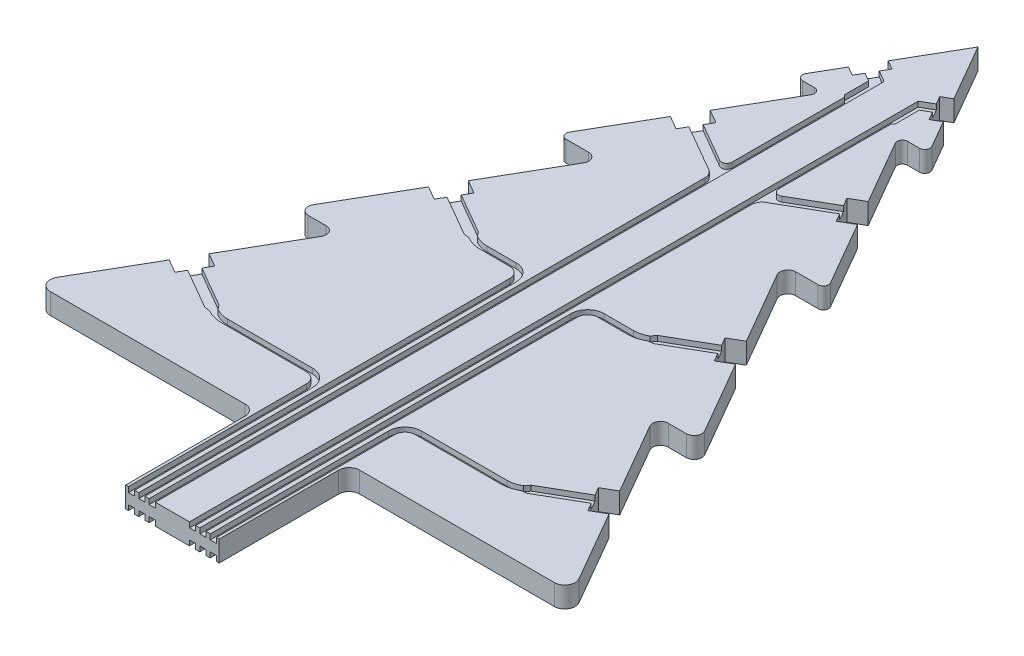
from build123d import *

# Parameters (mm, degrees)
ESBO_O1_W                       = 18
ESBO_O1_H                       = 25
RVORE_DEPTH                     = 4
FILETE2_R                       = 1
FILETE3_R                       = 1
FILETE4_R                       = 1
FILETE5_R                       = 1
FILETE6_R                       = 1
FILETE7_R                       = 1
FILETE8_R                       = 1.5
FILETE9_R                       = 1.5
FILETE10_R                      = 1.5
FILETE11_R                      = 1.5
FILETE12_R                      = 2
FILETE13_R                      = 2
FILETE14_R                      = 2
FILETE15_R                      = 2
FILETE16_R                      = 1.5
FILETE17_R                      = 1.5
CORTES_DO_LED_DEPTH             = 10
V_OS_DEPTH                      = 1
FILETE18_R                      = 2
FILETE19_R                      = 1
CHANFRO7_SIZE                   = 0.5
CORTE_EXTRUS_O1_START           = -1
CORTE_EXTRUS_O1_DEPTH           = 1
FILETE20_R                      = 1.5
FILETE21_R                      = 1.5
CHANFRO8_SIZE                   = 0.5
ESPELHAR_START                  = 3
ESPELHAR_V_OS_DA_FRENTE_DEPTH   = 1
ESPELHAR_V_OS_DA_TRASEIRA_DEPTH = 1


# Read off the part's stored shape, not the designer's step: Espelhar Vãos da Frente, Espelhar Vãos da Traseira
with BuildPart() as part:
    # Esboço1 → rvore (new body)
    with BuildSketch(Plane(origin=(0, 0, 0), x_dir=(1, 0, 0), z_dir=(0, 1, 0))):
        with Locations((0, -127.5)):
            Rectangle(ESBO_O1_W, ESBO_O1_H)
        Polygon((-51.961524227, -115), (-9, -115), (9, -115), (51.961524227, -115), (30.310889132, -77.5), (-30.310889132, -77.5), align=None)
        Polygon((-8.660254038, -40), (-30.310889132, -77.5), (30.310889132, -77.5), (8.660254038, -40), align=None)
        Polygon((-17.320508076, -40), (-8.660254038, -40), (0, -25), (8.660254038, -40), (17.320508076, -40), (0, -10), align=None)
        Polygon((8.660254038, -40), (30.310889132, -77.5), (38.97114317, -77.5), (17.320508076, -40), align=None)
        Polygon((0, -25), (-8.660254038, -40), (8.660254038, -40), align=None)
        Polygon((-38.97114317, -77.5), (-30.310889132, -77.5), (-8.660254038, -40), (-17.320508076, -40), align=None)
        Polygon((-25.980762114, -40), (-17.320508076, -40), (0, -10), (17.320508076, -40), (25.980762114, -40), (7.216878365, -7.5), (-7.216878365, -7.5), align=None)
        Polygon((0, 5), (-7.216878365, -7.5), (7.216878365, -7.5), align=None)
        Polygon((-12.990381057, -7.5), (-7.216878365, -7.5), (0, 5), (7.216878365, -7.5), (12.990381057, -7.5), (0, 15), align=None)
    extrude(amount=RVORE_DEPTH)

    # Filete2
    filete2_edges = [part.edges().sort_by_distance(p)[0] for p in [
        (12.990381057, 2, 7.5),
    ]]
    fillet(filete2_edges, radius=FILETE2_R)

    # Filete3
    filete3_edges = [part.edges().sort_by_distance(p)[0] for p in [
        (-12.990381057, 2, 7.5),
    ]]
    fillet(filete3_edges, radius=FILETE3_R)

    # Filete4
    filete4_edges = [part.edges().sort_by_distance(p)[0] for p in [
        (-7.216878365, 2, 7.5),
    ]]
    fillet(filete4_edges, radius=FILETE4_R)

    # Filete5
    filete5_edges = [part.edges().sort_by_distance(p)[0] for p in [
        (7.216878365, 2, 7.5),
    ]]
    fillet(filete5_edges, radius=FILETE5_R)

    # Filete6
    filete6_edges = [part.edges().sort_by_distance(p)[0] for p in [
        (25.980762114, 2, 40),
    ]]
    fillet(filete6_edges, radius=FILETE6_R)

    # Filete7
    filete7_edges = [part.edges().sort_by_distance(p)[0] for p in [
        (-25.980762114, 2, 40),
    ]]
    fillet(filete7_edges, radius=FILETE7_R)

    # Filete8
    filete8_edges = [part.edges().sort_by_distance(p)[0] for p in [
        (17.320508076, 2, 40),
    ]]
    fillet(filete8_edges, radius=FILETE8_R)

    # Filete9
    filete9_edges = [part.edges().sort_by_distance(p)[0] for p in [
        (-17.320508076, 2, 40),
    ]]
    fillet(filete9_edges, radius=FILETE9_R)

    # Filete10
    filete10_edges = [part.edges().sort_by_distance(p)[0] for p in [
        (38.97114317, 2, 77.5),
    ]]
    fillet(filete10_edges, radius=FILETE10_R)

    # Filete11
    filete11_edges = [part.edges().sort_by_distance(p)[0] for p in [
        (-38.97114317, 2, 77.5),
    ]]
    fillet(filete11_edges, radius=FILETE11_R)

    # Filete12
    filete12_edges = [part.edges().sort_by_distance(p)[0] for p in [
        (51.961524227, 2, 115),
    ]]
    fillet(filete12_edges, radius=FILETE12_R)

    # Filete13
    filete13_edges = [part.edges().sort_by_distance(p)[0] for p in [
        (-51.961524227, 2, 115),
    ]]
    fillet(filete13_edges, radius=FILETE13_R)

    # Filete14
    filete14_edges = [part.edges().sort_by_distance(p)[0] for p in [
        (9, 2, 115),
    ]]
    fillet(filete14_edges, radius=FILETE14_R)

    # Filete15
    filete15_edges = [part.edges().sort_by_distance(p)[0] for p in [
        (-9, 2, 115),
    ]]
    fillet(filete15_edges, radius=FILETE15_R)

    # Filete16
    filete16_edges = [part.edges().sort_by_distance(p)[0] for p in [
        (30.310889132, 2, 77.5),
    ]]
    fillet(filete16_edges, radius=FILETE16_R)

    # Filete17
    filete17_edges = [part.edges().sort_by_distance(p)[0] for p in [
        (-30.310889132, 2, 77.5),
    ]]
    fillet(filete17_edges, radius=FILETE17_R)

    # Esboço5 → Cortes do Led (cut)
    with BuildSketch(Plane(origin=(0, 4, 0), x_dir=(1, 0, 0), z_dir=(0, 1, 0))):
        Polygon((42.319473419, -98.299478112), (39.519473419, -93.449735851), (36.921397208, -94.949735851), (39.721397208, -99.799478112), align=None)
        Polygon((29.544605065, -61.172757061), (26.744605065, -56.3230148), (24.146528853, -57.8230148), (26.946528853, -62.672757061), align=None)
        Polygon((17.99973671, -26.176458504), (15.19973671, -21.326716243), (12.601660498, -22.826716243), (15.401660498, -27.676458504), align=None)
        Polygon((9.124355653, -0.803847577), (6.324355653, 4.045894684), (4.592304845, 3.045894684), (7.392304845, -1.803847577), align=None)
        Polygon((-9.124355653, -0.803847577), (-6.324355653, 4.045894684), (-4.592304845, 3.045894684), (-7.392304845, -1.803847577), align=None)
        Polygon((-17.99973671, -26.176458504), (-15.19973671, -21.326716243), (-12.601660498, -22.826716243), (-15.401660498, -27.676458504), align=None)
        Polygon((-29.544605065, -61.172757061), (-26.744605065, -56.3230148), (-24.146528853, -57.8230148), (-26.946528853, -62.672757061), align=None)
        Polygon((-42.319473419, -98.299478112), (-39.519473419, -93.449735851), (-36.921397208, -94.949735851), (-39.721397208, -99.799478112), align=None)
    extrude(amount=-CORTES_DO_LED_DEPTH, mode=Mode.SUBTRACT)

    # Esboço6 → Vãos (cut)
    with BuildSketch(Plane(origin=(0, 4, 0), x_dir=(1, 0, 0), z_dir=(0, 1, 0))):
        Polygon((3.275, -140), (4.475, -140), (4.475, -31.906507915), (14.501660498, -26.117612777), (13.501660498, -24.38556197), (4.475, -29.597106838), (4.475, -5.716873023), (4.875, -5.716873023), (4.875, -1.178753238), (6.492304845, -0.24500185), (5.492304845, 1.487048957), (3.275, 0.206887408), align=None)
        with BuildLine():
            Line((5.275, -68.59814367), (5.275, -140))
            Line((5.275, -140), (6.475, -140))
            Line((6.475, -140), (6.475, -68.59814367))
            ThreePointArc((6.475, -68.59814367), (7.060786438, -67.183930107), (8.475, -66.59814367))
            Line((8.475, -66.59814367), (14.086274815, -66.59814367))
            ThreePointArc((14.086274815, -66.59814367), (15.690952895, -66.386883793), (17.186274815, -65.767501173))
            Line((17.186274815, -65.767501173), (18.252300219, -65.613911335))
            Line((18.252300219, -65.613911335), (26.046528853, -61.113911335))
            Line((26.046528853, -61.113911335), (25.046528853, -59.381860527))
            Line((25.046528853, -59.381860527), (17.252300219, -63.881860527))
            Line((17.252300219, -63.881860527), (16.586274815, -64.728270689))
            ThreePointArc((16.586274815, -64.728270689), (15.380370041, -65.227772801), (14.086274815, -65.39814367))
            Line((14.086274815, -65.39814367), (8.475, -65.39814367))
            ThreePointArc((8.475, -65.39814367), (6.2122583, -66.33540197), (5.275, -68.59814367))
        make_face()
        with BuildLine():
            Line((7.275, -105.724864812), (7.275, -140))
            Line((7.275, -140), (8.475000015, -140))
            Line((8.475000015, -140), (8.475000015, -105.724864812))
            ThreePointArc((8.475000015, -105.724864812), (9.060786384, -104.310651231), (10.47499994, -103.724864804))
            Line((10.47499994, -103.724864804), (26.861143115, -103.724864804))
            ThreePointArc((26.861143115, -103.724864804), (28.465821237, -103.513604922), (29.96114317, -102.894222224))
            Line((29.96114317, -102.894222224), (31.027168574, -102.740632385))
            Line((31.027168574, -102.740632385), (38.821397208, -98.240632385))
            Line((38.821397208, -98.240632385), (37.821397208, -96.508581578))
            Line((37.821397208, -96.508581578), (30.027168574, -101.008581578))
            Line((30.027168574, -101.008581578), (29.36114317, -101.854991739))
            ThreePointArc((29.36114317, -101.854991739), (28.155238386, -102.354493946), (26.861143115, -102.52486482))
            Line((26.861143115, -102.52486482), (10.47499994, -102.52486482))
            ThreePointArc((10.47499994, -102.52486482), (8.212258253, -103.46212311), (7.275, -105.724864812))
        make_face()
    extrude(amount=-V_OS_DEPTH, mode=Mode.SUBTRACT)

    # Filete18
    filete18_edges = [part.edges().sort_by_distance(p)[0] for p in [
        (4.475, 3.5, 31.906507915),
    ]]
    fillet(filete18_edges, radius=FILETE18_R)

    # Filete19
    filete19_edges = [part.edges().sort_by_distance(p)[0] for p in [
        (4.475, 3.5, 29.597106838),
    ]]
    fillet(filete19_edges, radius=FILETE19_R)

    # Chanfro7
    # the kernel refuses this chamfer: 0.5 mm, written as the material it takes off along each edge
    with BuildSketch(Plane(origin=(4.475, 5.285841494, 5.716873023), x_dir=(-0.027495876610585647, 0, 0.9996219169112968), z_dir=(0, -1, 0))) as chanfro7_piece_1_section:
        Polygon((CHANFRO7_SIZE * 0.999621916911, -CHANFRO7_SIZE * 0.0274958766106), (-CHANFRO7_SIZE * 0.0274958766106, -CHANFRO7_SIZE * 0.999621916911), (0, 0), align=None)
    chanfro7_piece_1 = extrude(amount=2.285841494, mode=Mode.PRIVATE)
    chanfro7_piece_1 = split(chanfro7_piece_1, bisect_by=Plane(origin=(4.875, 3.5, 5.889095245), z_dir=(-1, 0, 0)), keep=Keep.TOP, mode=Mode.PRIVATE)
    add(chanfro7_piece_1, mode=Mode.SUBTRACT)

    # Esboço7 → Corte-extrusão1 (cut)
    with BuildSketch(Plane.XZ.offset(CORTE_EXTRUS_O1_START)):
        Polygon((4.875, 1.178753238), (4.875, 5.716873023), (4.475, 5.716873023), (4.475, 140), (3.275, 140), (3.275, -0.206887408), (5.492304845, -1.487048957), (6.492304845, 0.24500185), align=None)
        with BuildLine():
            Line((6.475, 140), (5.275, 140))
            Line((5.275, 140), (5.275, 30.867277431))
            ThreePointArc((5.275, 30.867277431), (5.569744112, 29.767277431), (6.375, 28.962021542))
            Line((6.375, 28.962021542), (6.573457268, 28.38556197))
            Line((6.573457268, 28.38556197), (13.501660498, 24.38556197))
            Line((13.501660498, 24.38556197), (14.501660498, 26.117612777))
            Line((14.501660498, 26.117612777), (7.573457268, 30.117612777))
            Line((7.573457268, 30.117612777), (6.975, 30.001252027))
            ThreePointArc((6.975, 30.001252027), (6.608974596, 30.367277431), (6.475, 30.867277431))
            Line((6.475, 30.867277431), (6.475, 140))
        make_face()
        with BuildLine():
            Line((8.475, 140), (7.275, 140))
            Line((7.275, 140), (7.275, 68.59814367))
            ThreePointArc((7.275, 68.59814367), (8.193190015, 66.354632316), (10.420839495, 65.39860204))
            ThreePointArc((10.420839495, 65.39860204), (10.447866811, 65.418301754), (10.475, 65.437855388))
            Line((10.475, 65.437855388), (10.475, 65.39814367))
            Line((10.475, 65.39814367), (14.086274815, 65.39814367))
            ThreePointArc((14.086274815, 65.39814367), (15.380370041, 65.227772801), (16.586274815, 64.728270689))
            Line((16.586274815, 64.728270689), (17.252300219, 63.881860527))
            Line((17.252300219, 63.881860527), (25.046528853, 59.381860527))
            Line((25.046528853, 59.381860527), (26.046528853, 61.113911335))
            Line((26.046528853, 61.113911335), (18.252300219, 65.613911335))
            Line((18.252300219, 65.613911335), (17.186274815, 65.767501173))
            ThreePointArc((17.186274815, 65.767501173), (15.690952895, 66.386883793), (14.086274815, 66.59814367))
            Line((14.086274815, 66.59814367), (10.475, 66.59814367))
            ThreePointArc((10.475, 66.59814367), (9.060786438, 67.183930107), (8.475, 68.59814367))
            Line((8.475, 68.59814367), (8.475, 102.52486472))
            Line((8.475, 102.52486472), (26.86114317, 102.52486472))
            ThreePointArc((26.86114317, 102.52486472), (28.155238396, 102.354493852), (29.36114317, 101.854991739))
            Line((29.36114317, 101.854991739), (30.027168574, 101.008581578))
            Line((30.027168574, 101.008581578), (37.821397208, 96.508581578))
            Line((37.821397208, 96.508581578), (38.821397208, 98.240632385))
            Line((38.821397208, 98.240632385), (31.027168574, 102.740632385))
            Line((31.027168574, 102.740632385), (29.96114317, 102.894222224))
            ThreePointArc((29.96114317, 102.894222224), (28.46582125, 103.513604843), (26.86114317, 103.72486472))
            Line((26.86114317, 103.72486472), (8.475, 103.72486472))
            Line((8.475, 103.72486472), (8.475, 140))
        make_face()
    extrude(amount=CORTE_EXTRUS_O1_DEPTH, mode=Mode.SUBTRACT)

    # Filete20
    filete20_edges = [part.edges().sort_by_distance(p)[0] for p in [
        (8.475, 0.5, 102.52486472),
    ]]
    fillet(filete20_edges, radius=FILETE20_R)

    # Filete21
    filete21_edges = [part.edges().sort_by_distance(p)[0] for p in [
        (8.475, 0.5, 103.72486472),
    ]]
    fillet(filete21_edges, radius=FILETE21_R)

    # Chanfro8
    # the kernel refuses this chamfer: 0.5 mm, written as the material it takes off along each edge
    with BuildSketch(Plane(origin=(4.475, 1, 5.716873023), x_dir=(-0.027495876610585647, 0, 0.9996219169112968), z_dir=(0, -1, 0))) as chanfro8_piece_1_section:
        Polygon((CHANFRO8_SIZE * 0.999621916911, -CHANFRO8_SIZE * 0.0274958766106), (-CHANFRO8_SIZE * 0.0274958766106, -CHANFRO8_SIZE * 0.999621916911), (0, 0), align=None)
    chanfro8_piece_1 = extrude(amount=2.285841494, mode=Mode.PRIVATE)
    chanfro8_piece_1 = split(chanfro8_piece_1, bisect_by=Plane(origin=(4.875, 0.5, 5.889095245), z_dir=(-1, 0, 0)), keep=Keep.TOP, mode=Mode.PRIVATE)
    add(chanfro8_piece_1, mode=Mode.SUBTRACT)

    # Espelhar Vãos da Frente outline → Espelhar Vãos da Frente (cut)
    with BuildSketch(Plane(origin=(0, 0, 0), x_dir=(1, 0, 0), z_dir=(0, 1, 0)).offset(ESPELHAR_START)):
        with BuildLine():
            Line((-4.475, -6.216873023), (-4.475, -27.865056031))
            ThreePointArc((-4.475, -27.865056031), (-4.975, -28.731081435), (-5.975, -28.731081435))
            Line((-5.975, -28.731081435), (-13.501660498, -24.38556197))
            Line((-13.501660498, -24.38556197), (-14.501660498, -26.117612777))
            Line((-14.501660498, -26.117612777), (-5.475, -31.329157646))
            ThreePointArc((-5.475, -31.329157646), (-4.742949192, -32.061208454), (-4.475, -33.061208454))
            Line((-4.475, -33.061208454), (-4.475, -140))
            Line((-4.475, -140), (-3.275, -140))
            Line((-3.275, -140), (-3.275, 0.206887408))
            Line((-3.275, 0.206887408), (-5.492304845, 1.487048957))
            Line((-5.492304845, 1.487048957), (-6.492304845, -0.24500185))
            Line((-6.492304845, -0.24500185), (-4.875, -1.178753238))
            Line((-4.875, -1.178753238), (-4.875, -5.816873023))
            Line((-4.875, -5.816873023), (-4.475, -6.216873023))
        make_face()
        with BuildLine():
            Line((-8.475000015, -140), (-7.275, -140))
            Line((-7.275, -140), (-7.274999974, -105.724864812))
            ThreePointArc((-7.274999974, -105.724864812), (-8.212258264, -103.462123136), (-10.47499994, -102.524864846))
            Line((-10.47499994, -102.524864846), (-26.861143115, -102.524864778))
            ThreePointArc((-26.861143115, -102.524864778), (-28.15523838, -102.354493904), (-29.361143191, -101.854991776))
            Line((-29.361143191, -101.854991776), (-30.027168574, -101.008581578))
            Line((-30.027168574, -101.008581578), (-37.821397208, -96.508581578))
            Line((-37.821397208, -96.508581578), (-38.821397208, -98.240632385))
            Line((-38.821397208, -98.240632385), (-31.027168574, -102.740632385))
            Line((-31.027168574, -102.740632385), (-29.961143187, -102.894222253))
            ThreePointArc((-29.961143187, -102.894222253), (-28.465821232, -103.513604887), (-26.861143115, -103.724864769))
            Line((-26.861143115, -103.724864769), (-10.47499994, -103.724864845))
            ThreePointArc((-10.47499994, -103.724864845), (-9.060786401, -104.310651273), (-8.474999973, -105.724864812))
            Line((-8.474999973, -105.724864812), (-8.475000015, -140))
        make_face()
        with BuildLine():
            Line((-6.475, -140), (-5.275, -140))
            Line((-5.275, -140), (-5.275, -68.59814367))
            ThreePointArc((-5.275, -68.59814367), (-6.2122583, -66.33540197), (-8.475, -65.39814367))
            Line((-8.475, -65.39814367), (-14.086274815, -65.39814367))
            ThreePointArc((-14.086274815, -65.39814367), (-15.38037004, -65.227772801), (-16.586274815, -64.728270689))
            Line((-16.586274815, -64.728270689), (-17.252300219, -63.881860527))
            Line((-17.252300219, -63.881860527), (-25.046528853, -59.381860527))
            Line((-25.046528853, -59.381860527), (-26.046528853, -61.113911335))
            Line((-26.046528853, -61.113911335), (-18.252300219, -65.613911335))
            Line((-18.252300219, -65.613911335), (-17.186274815, -65.767501173))
            ThreePointArc((-17.186274815, -65.767501173), (-15.690952895, -66.386883793), (-14.086274815, -66.59814367))
            Line((-14.086274815, -66.59814367), (-8.475, -66.59814367))
            ThreePointArc((-8.475, -66.59814367), (-7.060786437, -67.183930108), (-6.475, -68.59814367))
            Line((-6.475, -68.59814367), (-6.475, -140))
        make_face()
    extrude(amount=ESPELHAR_V_OS_DA_FRENTE_DEPTH, mode=Mode.SUBTRACT)

    # Espelhar Vãos da Traseira outline → Espelhar Vãos da Traseira (cut)
    with BuildSketch(Plane(origin=(0, 0, 0), x_dir=(1, 0, 0), z_dir=(0, 1, 0))):
        with BuildLine():
            Line((-26.86114317, -103.72486472), (-9.975, -103.72486472))
            ThreePointArc((-9.975, -103.72486472), (-8.914339829, -104.164204549), (-8.475, -105.22486472))
            Line((-8.475, -105.22486472), (-8.475, -140))
            Line((-8.475, -140), (-7.275, -140))
            Line((-7.275, -140), (-7.275, -68.59814367))
            ThreePointArc((-7.275, -68.59814367), (-8.193190015, -66.354632316), (-10.420839495, -65.39860204))
            ThreePointArc((-10.420839495, -65.39860204), (-10.447866811, -65.418301754), (-10.475, -65.437855388))
            Line((-10.475, -65.437855388), (-10.475, -65.39814367))
            Line((-10.475, -65.39814367), (-14.086274815, -65.39814367))
            ThreePointArc((-14.086274815, -65.39814367), (-15.38037004, -65.227772801), (-16.586274815, -64.728270689))
            Line((-16.586274815, -64.728270689), (-17.252300219, -63.881860527))
            Line((-17.252300219, -63.881860527), (-25.046528853, -59.381860527))
            Line((-25.046528853, -59.381860527), (-26.046528853, -61.113911335))
            Line((-26.046528853, -61.113911335), (-18.252300219, -65.613911335))
            Line((-18.252300219, -65.613911335), (-17.186274815, -65.767501173))
            ThreePointArc((-17.186274815, -65.767501173), (-15.690952895, -66.386883793), (-14.086274815, -66.59814367))
            Line((-14.086274815, -66.59814367), (-10.475, -66.59814367))
            ThreePointArc((-10.475, -66.59814367), (-9.060786437, -67.183930107), (-8.475, -68.59814367))
            Line((-8.475, -68.59814367), (-8.475, -101.02486472))
            ThreePointArc((-8.475, -101.02486472), (-8.914339828, -102.085524892), (-9.975, -102.52486472))
            Line((-9.975, -102.52486472), (-26.86114317, -102.52486472))
            ThreePointArc((-26.86114317, -102.52486472), (-28.155238396, -102.354493852), (-29.36114317, -101.854991739))
            Line((-29.36114317, -101.854991739), (-30.027168574, -101.008581578))
            Line((-30.027168574, -101.008581578), (-37.821397208, -96.508581578))
            Line((-37.821397208, -96.508581578), (-38.821397208, -98.240632385))
            Line((-38.821397208, -98.240632385), (-31.027168574, -102.740632385))
            Line((-31.027168574, -102.740632385), (-29.96114317, -102.894222224))
            ThreePointArc((-29.96114317, -102.894222224), (-28.46582125, -103.513604843), (-26.86114317, -103.72486472))
        make_face()
        Polygon((-4.475, -6.216873023), (-4.475, -140), (-3.275, -140), (-3.275, 0.206887408), (-5.492304845, 1.487048957), (-6.492304845, -0.24500185), (-4.875, -1.178753238), (-4.875, -5.816873023), align=None)
        with BuildLine():
            Line((-6.475, -30.867277431), (-6.475, -140))
            Line((-6.475, -140), (-5.275, -140))
            Line((-5.275, -140), (-5.275, -30.867277431))
            ThreePointArc((-5.275, -30.867277431), (-5.569744112, -29.767277431), (-6.375, -28.962021542))
            Line((-6.375, -28.962021542), (-6.573457268, -28.38556197))
            Line((-6.573457268, -28.38556197), (-13.501660498, -24.38556197))
            Line((-13.501660498, -24.38556197), (-14.501660498, -26.117612777))
            Line((-14.501660498, -26.117612777), (-7.573457268, -30.117612777))
            Line((-7.573457268, -30.117612777), (-6.975, -30.001252027))
            ThreePointArc((-6.975, -30.001252027), (-6.608974596, -30.367277431), (-6.475, -30.867277431))
        make_face()
    extrude(amount=ESPELHAR_V_OS_DA_TRASEIRA_DEPTH, mode=Mode.SUBTRACT)


solid = part.part
